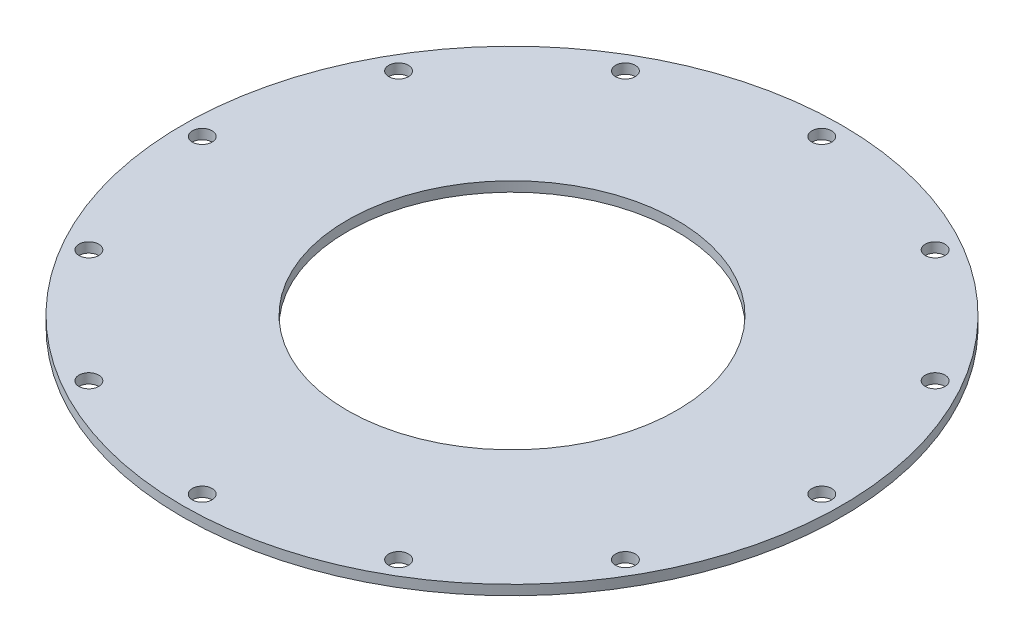
from build123d import *

# Parameters (mm, degrees)
SKETCH1_R                     = 100
SKETCH1_R_2                   = 50
BASE_DEPTH                    = 1.5
SKETCH2_R                     = 3
STRUCTURAL_HOLE_DEPTH         = 142.453172464
STRUCTURAL_HOLE_PATTERN_COUNT = 6
SKETCH3_R                     = 3
BEARING_HOLE_DEPTH            = 142.453172464
BEARING_HOLE_PATTERN_COUNT    = 6


with BuildPart() as part:
    # Sketch1 → Base (new, symmetric)
    with BuildSketch(Plane(origin=(0, 0, 0), x_dir=(1, 0, 0), z_dir=(0, 1, 0))):
        Circle(SKETCH1_R)
        Circle(SKETCH1_R_2, mode=Mode.SUBTRACT)
    extrude(amount=BASE_DEPTH, both=True)

    # Sketch2 → Structural Hole (cut, through all)
    with BuildSketch(Plane(origin=(0, 1.5, 0), x_dir=(1, 0, 0), z_dir=(0, 1, 0))):
        with Locations((0, 94)):
            Circle(SKETCH2_R)
    structural_hole = extrude(amount=-STRUCTURAL_HOLE_DEPTH, mode=Mode.SUBTRACT)

    # Structural Hole Pattern: Structural Hole ×6 about axis
    structural_hole_pattern_axis = Axis((0, 1.5, 0), (0, -1, 0))
    for i in range(1, STRUCTURAL_HOLE_PATTERN_COUNT):
        add(structural_hole.rotate(structural_hole_pattern_axis, i * 360 / STRUCTURAL_HOLE_PATTERN_COUNT), mode=Mode.SUBTRACT)

    # Sketch3 → Bearing Hole (cut, through all)
    with BuildSketch(Plane(origin=(0, 1.5, 0), x_dir=(1, 0, 0), z_dir=(0, 1, 0))):
        with Locations((47, 81.406387956)):
            Circle(SKETCH3_R)
    bearing_hole = extrude(amount=-BEARING_HOLE_DEPTH, mode=Mode.SUBTRACT)

    # Bearing Hole Pattern: Bearing Hole ×6 about axis
    bearing_hole_pattern_axis = Axis((0, 1.5, 0), (0, -1, 0))
    for i in range(1, BEARING_HOLE_PATTERN_COUNT):
        add(bearing_hole.rotate(bearing_hole_pattern_axis, i * 360 / BEARING_HOLE_PATTERN_COUNT), mode=Mode.SUBTRACT)


solid = part.part
